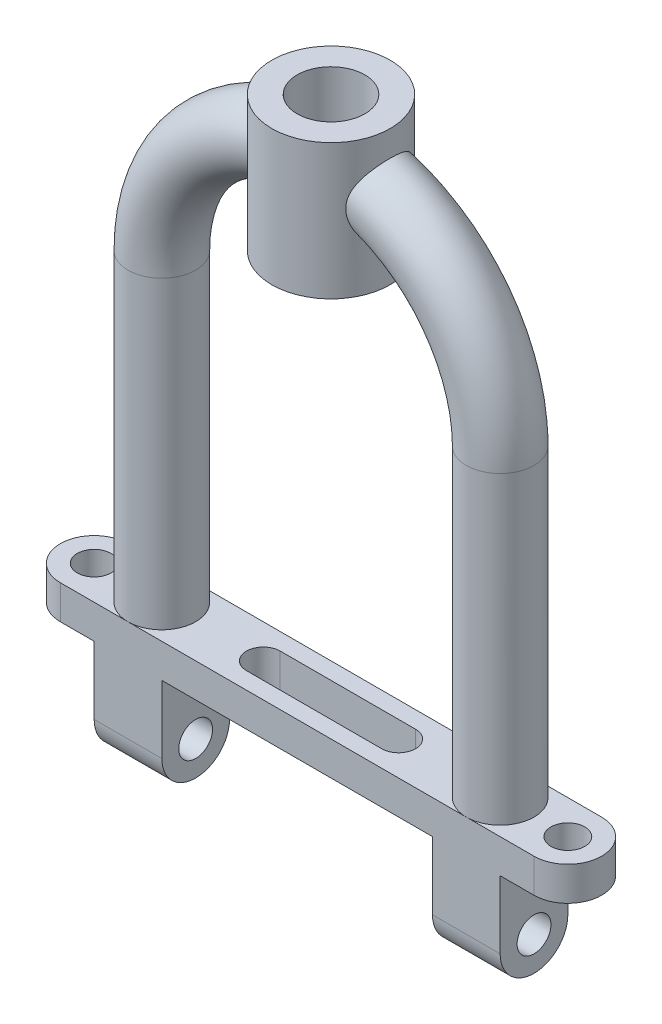
from build123d import *

# Parameters (mm, degrees)
ESBO_O1_R                = 0.25
RESSALTO_EXTRUS_O1_DEPTH = 0.25
ESBO_O2_R                = 0.5
ESBO_O5_R                = 0.25
RESSALTO_EXTRUS_O2_DEPTH = 0.5
ESBO_O6_R                = 0.875
RESSALTO_EXTRUS_O3_DEPTH = 2
ESBO_O7_R                = 0.5
CORTE_EXTRUS_O1_DEPTH    = 2


with BuildPart() as part:
    # Esboço1 → Ressalto-extrusão1 (new, symmetric)
    with BuildSketch(Plane(origin=(0, 0, 0), x_dir=(1, 0, 0), z_dir=(0, 1, 0))):
        with BuildLine():
            Line((-3.5, 0.5), (3.5, 0.5))
            ThreePointArc((3.5, 0.5), (4, 0), (3.5, -0.5))
            Line((3.5, -0.5), (-3.5, -0.5))
            ThreePointArc((-3.5, -0.5), (-4, 0), (-3.5, 0.5))
        make_face()
        with Locations((3.5, 0)):
            Circle(ESBO_O1_R, mode=Mode.SUBTRACT)
        with Locations((-3.5, 0)):
            Circle(ESBO_O1_R, mode=Mode.SUBTRACT)
        with BuildLine():
            Line((-1, 0.25), (1, 0.25))
            ThreePointArc((1, 0.25), (1.25, 0), (1, -0.25))
            Line((1, -0.25), (-1, -0.25))
            ThreePointArc((-1, -0.25), (-1.25, 0), (-1, 0.25))
        make_face(mode=Mode.SUBTRACT)
    extrude(amount=RESSALTO_EXTRUS_O1_DEPTH, both=True)

    # Varredura1: sweep along a path in Esboço3
    with BuildLine(Plane.XY) as varredura1_path:
        Line((-2.5, 0.25), (-2.5, 4.75))
        ThreePointArc((-2.5, 4.75), (0, 7.25), (2.5, 4.75))
        Line((2.5, 4.75), (2.5, 0.25))
    # Esboço2 → Varredura1 (sweep)
    with BuildSketch(Plane(origin=(0, 0.25, 0), x_dir=(1, 0, 0), z_dir=(0, 1, 0))):
        with Locations((-2.5, 0)):
            Circle(ESBO_O2_R)
    sweep(path=varredura1_path.line)

    # Esboço5 → Ressalto-extrusão2 (add, symmetric)
    with BuildSketch(Plane(origin=(-2.5, 0, 0), x_dir=(0, 0, -1), z_dir=(1, 0, 0))):
        with BuildLine():
            Line((0.5, -0.25), (-0.5, -0.25))
            Line((-0.5, -0.25), (-0.5, -1.25))
            ThreePointArc((-0.5, -1.25), (0, -1.75), (0.5, -1.25))
            Line((0.5, -1.25), (0.5, -0.25))
        make_face()
        with Locations((0, -1.25)):
            Circle(ESBO_O5_R, mode=Mode.SUBTRACT)
    ressalto_extrus_o2 = extrude(amount=RESSALTO_EXTRUS_O2_DEPTH, both=True)

    # Espelhar1: Ressalto-extrusão2 across plane
    add(ressalto_extrus_o2.mirror(Plane(origin=(0, 0, 0), x_dir=(0, 0, 1), z_dir=(1, 0, 0))))

    # Esboço6 → Ressalto-extrusão3 (add)
    with BuildSketch(Plane(origin=(0, 6, 0), x_dir=(1, 0, 0), z_dir=(0, 1, 0))):
        Circle(ESBO_O6_R)
    extrude(amount=RESSALTO_EXTRUS_O3_DEPTH)

    # Esboço7 → Corte-extrusão1 (cut)
    with BuildSketch(Plane(origin=(0, 8, 0), x_dir=(1, 0, 0), z_dir=(0, 1, 0))):
        Circle(ESBO_O7_R)
    extrude(amount=-CORTE_EXTRUS_O1_DEPTH, mode=Mode.SUBTRACT)


solid = part.part
